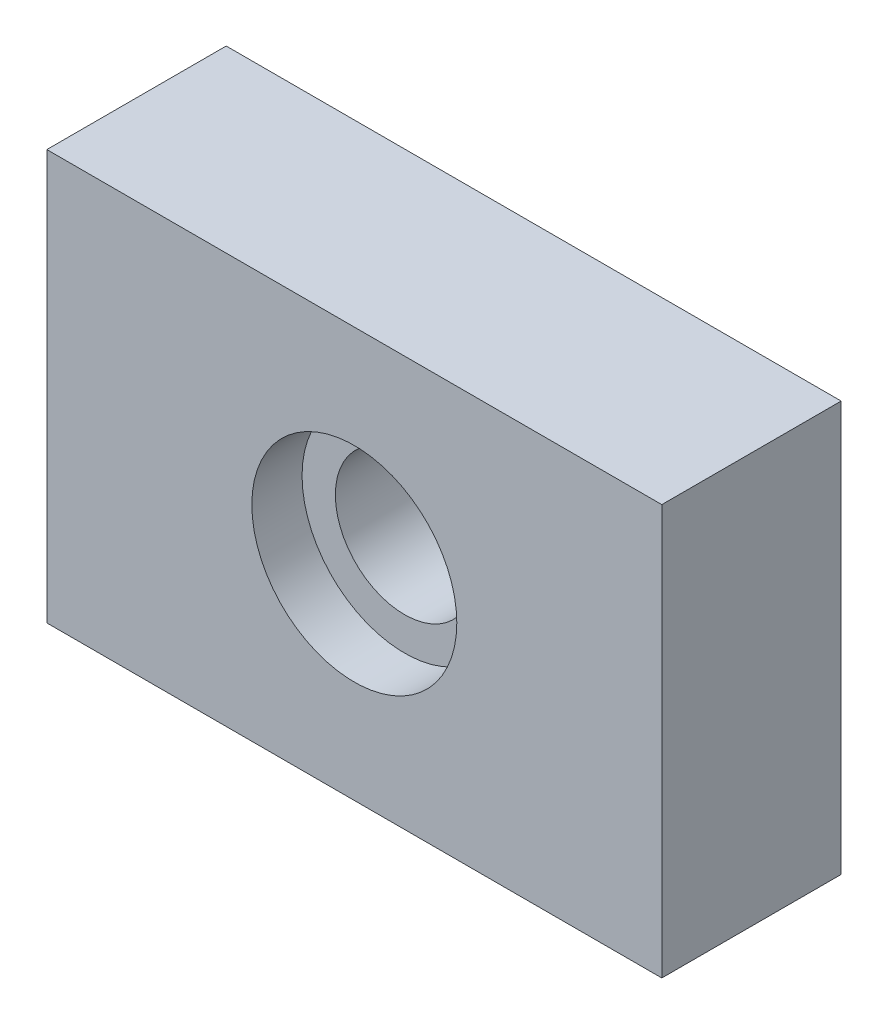
from build123d import *

# Parameters (mm, degrees)
SKETCH1_W           = 152.4
SKETCH1_H           = 101.6
BOSS_EXTRUDE1_DEPTH = 44.45
SKETCH2_R           = 17.145
CUT_EXTRUDE1_DEPTH  = 189.478440412
SKETCH2_2_R         = 25.4
SKETCH2_2_R_2       = 17.145
CUT_EXTRUDE3_DEPTH  = 12.446


with BuildPart() as part:
    # Sketch1 → Boss-Extrude1 (new body)
    with BuildSketch(Plane.XY):
        with Locations((76.2, 50.8)):
            Rectangle(SKETCH1_W, SKETCH1_H)
    extrude(amount=BOSS_EXTRUDE1_DEPTH)

    # Sketch2 → Cut-Extrude1 (cut, through all)
    with BuildSketch(Plane(origin=(0, 0, 0), x_dir=(-1, 0, 0), z_dir=(0, 0, -1))):
        with Locations((-76.2, 50.8)):
            Circle(SKETCH2_R)
    extrude(amount=-CUT_EXTRUDE1_DEPTH, mode=Mode.SUBTRACT)

    # Sketch2<2> → Cut-Extrude3 (cut)
    with BuildSketch(Plane(origin=(0, 0, 0), x_dir=(-1, 0, 0), z_dir=(0, 0, -1))):
        with Locations((-76.2, 50.8)):
            Circle(SKETCH2_2_R)
        with Locations((-76.2, 50.8)):
            Circle(SKETCH2_2_R_2, mode=Mode.SUBTRACT)
    cut_extrude3 = extrude(amount=-CUT_EXTRUDE3_DEPTH, mode=Mode.SUBTRACT)

    # Mirror2: Cut-Extrude3 across plane
    add(cut_extrude3.mirror(Plane(origin=(0, 0, 22.225), x_dir=(1, 0, 0), z_dir=(0, 0, -1))), mode=Mode.SUBTRACT)


solid = part.part
